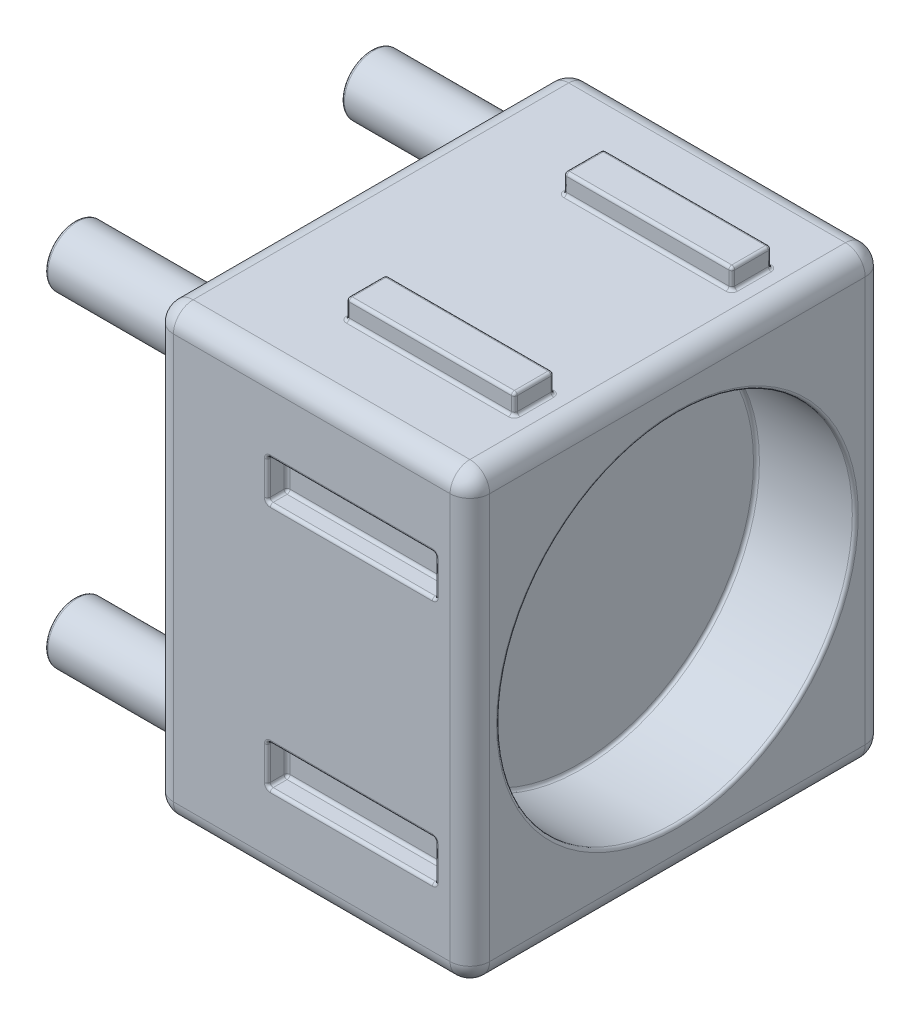
from build123d import *

# Parameters (mm, degrees)
SKETCH1_W           = 16
SKETCH1_H           = 21
BOSS_EXTRUDE1_DEPTH = 22.5
SKETCH2_R           = 9
CUT_EXTRUDE1_DEPTH  = 5
SKETCH3_R           = 1.5
BOSS_EXTRUDE2_DEPTH = 7
SKETCH4_R           = 1.5
BOSS_EXTRUDE3_DEPTH = 5
FILLET3_R           = 1
SKETCH5_W           = 8.5
SKETCH5_H           = 2
CUT_EXTRUDE2_DEPTH  = 1
SKETCH6_W           = 8.5
SKETCH6_H           = 2
CUT_EXTRUDE3_DEPTH  = 1
SKETCH7_W           = 8.5
SKETCH7_H           = 2
BOSS_EXTRUDE4_DEPTH = 1
SKETCH8_W           = 8.5
SKETCH8_H           = 2
BOSS_EXTRUDE5_DEPTH = 1
FILLET4_R           = 0.15
FILLET5_R           = 0.15
FILLET6_R           = 0.15


with BuildPart() as part:
    # Sketch1 → Boss-Extrude1 (new body)
    with BuildSketch(Plane(origin=(0, 0, 0), x_dir=(1, 0, 0), z_dir=(0, 1, 0))):
        Rectangle(SKETCH1_W, SKETCH1_H)
    extrude(amount=BOSS_EXTRUDE1_DEPTH)

    # Sketch2 → Cut-Extrude1 (cut)
    with BuildSketch(Plane(origin=(8, 0, 0), x_dir=(0, 0, -1), z_dir=(1, 0, 0))):
        with Locations((0, 11.25)):
            Circle(SKETCH2_R)
    extrude(amount=-CUT_EXTRUDE1_DEPTH, mode=Mode.SUBTRACT)

    # Sketch3 → Boss-Extrude2 (add)
    with BuildSketch(Plane.ZY.offset(8)):
        with Locations((7.5, 19.5)):
            Circle(SKETCH3_R)
        with Locations((7.5, 3)):
            Circle(SKETCH3_R)
        with Locations((-7.5, 19.5)):
            Circle(SKETCH3_R)
        with Locations((-7.5, 3)):
            Circle(SKETCH3_R)
    extrude(amount=BOSS_EXTRUDE2_DEPTH)

    # Sketch4 → Boss-Extrude3 (add)
    with BuildSketch(Plane.ZY.offset(8)):
        with Locations((0, 11.25)):
            Circle(SKETCH4_R)
    extrude(amount=BOSS_EXTRUDE3_DEPTH)

    # Fillet3
    fillet3_edges = [part.edges().sort_by_distance(p)[0] for p in [
        (-8, 11.25, -10.5),
        (0, 22.5, -10.5),
        (0, 0, -10.5),
        (-8, 0, 0),
        (0, 22.5, 10.5),
        (-8, 22.5, 0),
        (-8, 11.25, 10.5),
        (0, 0, 10.5),
        (8, 11.25, 10.5),
        (8, 0, 0),
        (8, 11.25, -10.5),
        (8, 22.5, 0),
    ]]
    fillet(fillet3_edges, radius=FILLET3_R)

    # Sketch5 → Cut-Extrude2 (cut)
    with BuildSketch(Plane(origin=(0, 0, 0), x_dir=(-1, 0, 0), z_dir=(0, -1, 0))):
        with Locations((2, 5.5)):
            Rectangle(SKETCH5_W, SKETCH5_H)
        with Locations((2, -5.5)):
            Rectangle(SKETCH5_W, SKETCH5_H)
    extrude(amount=-CUT_EXTRUDE2_DEPTH, mode=Mode.SUBTRACT)

    # Sketch6 → Cut-Extrude3 (cut)
    with BuildSketch(Plane.XY.offset(10.5)):
        with Locations((2, 5)):
            Rectangle(SKETCH6_W, SKETCH6_H)
        with Locations((2, 17.5)):
            Rectangle(SKETCH6_W, SKETCH6_H)
    extrude(amount=-CUT_EXTRUDE3_DEPTH, mode=Mode.SUBTRACT)

    # Sketch7 → Boss-Extrude4 (add)
    with BuildSketch(Plane(origin=(0, 22.5, 0), x_dir=(1, 0, 0), z_dir=(0, 1, 0))):
        with Locations((2, -5.5)):
            Rectangle(SKETCH7_W, SKETCH7_H)
        with Locations((2, 5.5)):
            Rectangle(SKETCH7_W, SKETCH7_H)
    extrude(amount=BOSS_EXTRUDE4_DEPTH)

    # Sketch8 → Boss-Extrude5 (add)
    with BuildSketch(Plane(origin=(0, 0, -10.5), x_dir=(-1, 0, 0), z_dir=(0, 0, -1))):
        with Locations((-2, 17.5)):
            Rectangle(SKETCH8_W, SKETCH8_H)
        with Locations((-2, 5)):
            Rectangle(SKETCH8_W, SKETCH8_H)
    extrude(amount=BOSS_EXTRUDE5_DEPTH)

    # Fillet4
    fillet4_edges = [part.edges().sort_by_distance(p)[0] for p in [
        (-2.25, 17.5, 9.5),
        (-2.25, 17.5, 10.5),
        (2, 18.5, 9.5),
        (-2.25, 18.5, 10),
        (2, 18.5, 10.5),
        (6.25, 17.5, 9.5),
        (6.25, 18.5, 10),
        (6.25, 17.5, 10.5),
        (-2.25, 16.5, 10),
        (2, 16.5, 9.5),
        (6.25, 16.5, 10),
        (2, 16.5, 10.5),
        (2, 4, 9.5),
        (2, 4, 10.5),
        (6.25, 4, 10),
        (6.25, 5, 9.5),
        (6.25, 5, 10.5),
        (6.25, 6, 10),
        (2, 6, 9.5),
        (2, 6, 10.5),
        (-2.25, 6, 10),
        (-2.25, 5, 9.5),
        (-2.25, 4, 10),
        (-2.25, 5, 10.5),
        (2.25, 1, 5.5),
        (2.25, 0, 5.5),
        (2.25, 0.5, 6.5),
        (-2, 1, 6.5),
        (-2, 0, 6.5),
        (-2, 1, 4.5),
        (2.25, 0.5, 4.5),
        (-2, 0, 4.5),
        (-6.25, 0.5, 6.5),
        (-6.25, 1, 5.5),
        (-6.25, 0.5, 4.5),
        (-6.25, 0, 5.5),
        (-6.25, 1, -5.5),
        (-6.25, 0, -5.5),
        (-6.25, 0.5, -6.5),
        (-2, 1, -6.5),
        (-2, 0, -6.5),
        (2.25, 0.5, -6.5),
        (2.25, 1, -5.5),
        (2.25, 0, -5.5),
        (2.25, 0.5, -4.5),
        (-2, 1, -4.5),
        (-6.25, 0.5, -4.5),
        (-2, 0, -4.5),
        (-2.25, 5, -11.5),
        (-2.25, 5, -10.5),
        (-2.25, 6, -11),
        (2, 6, -11.5),
        (2, 6, -10.5),
        (2, 4, -11.5),
        (-2.25, 4, -11),
        (2, 4, -10.5),
        (6.25, 6, -11),
        (6.25, 5, -11.5),
        (6.25, 4, -11),
        (6.25, 5, -10.5),
        (6.25, 17.5, -11.5),
        (6.25, 17.5, -10.5),
        (6.25, 16.5, -11),
        (2, 16.5, -11.5),
        (2, 16.5, -10.5),
        (-2.25, 16.5, -11),
        (-2.25, 17.5, -11.5),
        (-2.25, 17.5, -10.5),
        (-2.25, 18.5, -11),
        (2, 18.5, -11.5),
        (6.25, 18.5, -11),
        (2, 18.5, -10.5),
        (-2.25, 23.5, -5.5),
        (-2.25, 22.5, -5.5),
        (-2.25, 23, -4.5),
        (2, 23.5, -4.5),
        (2, 22.5, -4.5),
        (2, 23.5, -6.5),
        (-2.25, 23, -6.5),
        (2, 22.5, -6.5),
        (6.25, 23, -4.5),
        (6.25, 23.5, -5.5),
        (6.25, 23, -6.5),
        (6.25, 22.5, -5.5),
        (2, 23.5, 4.5),
        (2, 22.5, 4.5),
        (6.25, 23.5, 5.5),
        (6.25, 23, 4.5),
        (6.25, 22.5, 5.5),
        (2, 23.5, 6.5),
        (6.25, 23, 6.5),
        (2, 22.5, 6.5),
        (-2.25, 23, 4.5),
        (-2.25, 23.5, 5.5),
        (-2.25, 23, 6.5),
        (-2.25, 22.5, 5.5),
    ]]
    fillet(fillet4_edges, radius=FILLET4_R)

    # Fillet5
    fillet5_edges = [part.edges().sort_by_distance(p)[0] for p in [
        (-8, 3, 6),
        (-15, 3, 6),
        (-8, 19.5, 6),
        (-15, 19.5, 6),
        (-8, 19.5, -9),
        (-15, 19.5, -9),
        (-8, 11.25, -1.5),
        (-13, 11.25, -1.5),
        (-8, 3, -9),
        (-15, 3, -9),
    ]]
    fillet(fillet5_edges, radius=FILLET5_R)

    # Fillet6
    fillet6_edges = [part.edges().sort_by_distance(p)[0] for p in [
        (8, 11.25, 9),
        (3, 11.25, 9),
    ]]
    fillet(fillet6_edges, radius=FILLET6_R)


solid = part.part
